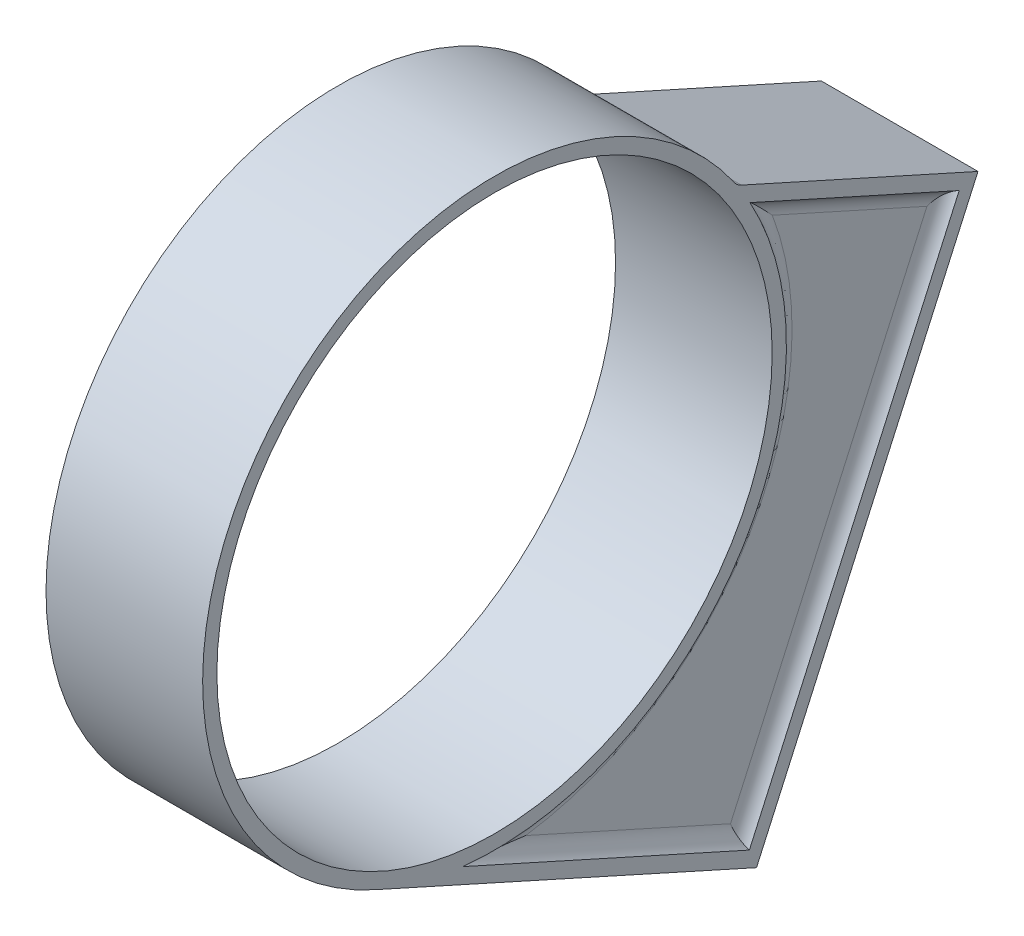
from build123d import *

# Parameters (mm, degrees)
SKETCH1_R           = 205
SKETCH1_R_2         = 195
BOSS_EXTRUDE1_DEPTH = 110
CUT_EXTRUDE1_START  = 41.95
CUT_EXTRUDE1_DEPTH  = 26.1
BOSS_EXTRUDE3_DEPTH = 110
SKETCH5_R           = 10
CUT_EXTRUDE2_DEPTH  = 140
FILLET1_R           = 12.5
CUT_EXTRUDE4_START  = -7.5
CUT_EXTRUDE4_DEPTH  = 7.5
CUT_EXTRUDE5_DEPTH  = 7.5
FILLET2_R           = 12.5


with BuildPart() as part:
    # Sketch1 → Boss-Extrude1 (new body)
    with BuildSketch(Plane(origin=(0, 0, 0), x_dir=(0, 0, -1), z_dir=(1, 0, 0))):
        Circle(SKETCH1_R)
        Circle(SKETCH1_R_2, mode=Mode.SUBTRACT)
    extrude(amount=BOSS_EXTRUDE1_DEPTH)

    # Sketch3 → Cut-Extrude1 (cut)
    with BuildSketch(Plane(origin=(0, 0, 0), x_dir=(0, 0, -1), z_dir=(1, 0, 0)).offset(CUT_EXTRUDE1_START)):
        with BuildLine():
            Line((160.8479694, 127.09418059), (137.885822331, 137.885822331))
            ThreePointArc((137.885822331, 137.885822331), (143.004745144, 132.569388874), (147.918824855, 127.063060145))
            Line((147.918824855, 127.063060145), (167.43543162, 118.280920855))
            ThreePointArc((167.43543162, 118.280920855), (164.200841146, 122.731755332), (160.8479694, 127.09418059))
        make_face()
    extrude(amount=CUT_EXTRUDE1_DEPTH, mode=Mode.SUBTRACT)

    # Sketch4 → Boss-Extrude3 (add)
    with BuildSketch(Plane.ZY):
        with BuildLine():
            Line((-339.535373084, 38.097443801), (-170.172659449, 114.307768661))
            ThreePointArc((-170.172659449, 114.307768661), (-156.650879802, -132.232756371), (84.122100255, -186.945104907))
            Line((84.122100255, -186.945104907), (-183.982931916, -307.587784512))
            Line((-183.982931916, -307.587784512), (-339.535373084, 38.097443801))
        make_face()
    extrude(amount=-BOSS_EXTRUDE3_DEPTH)

    # Sketch5 → Cut-Extrude2 (cut)
    with BuildSketch(Plane(origin=(0, -120.642679605, -268.105032171), x_dir=(-1, 0, 0), z_dir=(0, -0.41035170855993064, -0.9119273410102067))):
        with Locations(Location((-90, -185, 0), (0, 0, 90))):
            Circle(SKETCH5_R)
        with Locations(Location((-20, -185, 0), (0, 0, 90))):
            Circle(SKETCH5_R)
        with Locations(Location((-20, 154.071021086, 0), (0, 0, 90))):
            Circle(SKETCH5_R)
        with Locations(Location((-90, 154.071021086, 0), (0, 0, 90))):
            Circle(SKETCH5_R)
    extrude(amount=-CUT_EXTRUDE2_DEPTH, mode=Mode.SUBTRACT)

    # Fillet1
    fillet1_edges = [part.edges().sort_by_distance(p)[0] for p in [
        (55, 114.307768661, -170.172659449),
    ]]
    fillet(fillet1_edges, radius=FILLET1_R)

    # Sketch6 → Cut-Extrude4 (cut)
    with BuildSketch(Plane(origin=(110, 0, 0), x_dir=(0, 0, -1), z_dir=(1, 0, 0)).offset(CUT_EXTRUDE4_START)):
        with BuildLine():
            Line((326.312582588, 33.081687477), (179.407480032, 99.186471399))
            ThreePointArc((179.407480032, 99.186471399), (170.629059775, -113.625366712), (-22.343234006, -203.778752313))
            Line((-22.343234006, -203.778752313), (178.967175591, -294.364994017))
            Line((178.967175591, -294.364994017), (326.312582588, 33.081687477))
        make_face()
    extrude(amount=CUT_EXTRUDE4_DEPTH, mode=Mode.SUBTRACT)

    # Sketch7 → Cut-Extrude5 (cut)
    with BuildSketch(Plane.ZY):
        with BuildLine():
            Line((-179.407480032, 99.186471399), (-326.312582588, 33.081687477))
            Line((-326.312582588, 33.081687477), (-178.967175591, -294.364994017))
            Line((-178.967175591, -294.364994017), (22.343234006, -203.778752313))
            ThreePointArc((22.343234006, -203.778752313), (-170.629059775, -113.625366712), (-179.407480032, 99.186471399))
        make_face()
    extrude(amount=-CUT_EXTRUDE5_DEPTH, mode=Mode.SUBTRACT)

    # Fillet2
    # the kernel refuses this fillet: 12.5 mm, written as the material it adds along each edge
    with BuildSketch(Plane(origin=(102.5, -192.025828775, 48.461834434), x_dir=(1, 0, 0), z_dir=(0, -0.4103517085599303, -0.9119273410102069))) as fillet2_piece_1_section:
        with BuildLine():
            CenterArc((12.5, -11.456439237), FILLET2_R, 113.578178478, 66.421821522)
            Line((0, -11.456439237), (0, 0))
            Line((0, 0), (7.5, 0))
        make_face()
    fillet2_piece_1 = extrude(amount=249.39378369, mode=Mode.PRIVATE)
    fillet2_piece_1 = fillet2_piece_1 - Plane(origin=(104.520833168, 0, 0), x_dir=(0, 0.4838364458471492, -0.8751584391811569), z_dir=(-1, 0, 0)) * Cylinder(205, 545, mode=Mode.PRIVATE)
    add(fillet2_piece_1)
    with BuildSketch(Plane(origin=(102.5, 0, 0), x_dir=(0, 0.6010821181754732, -0.7991872666713895), z_dir=(0, 0.7991872666713895, 0.6010821181754732))) as fillet2_piece_2_section:
        with BuildLine():
            CenterArc((216.456439237, -12.5), FILLET2_R, 90, 66.421821522)
            Line((216.456439237, 0), (205, 0))
            Line((205, 0), (205, -7.5))
        make_face()
    fillet2_piece_2 = revolve(axis=Axis((102.5, 0, 0), (-1, 0, 0)), revolution_arc=141.215785086, mode=Mode.PRIVATE)
    fillet2_piece_2 = split(fillet2_piece_2, bisect_by=Plane(origin=(104.520833168, -262.670858667, -108.533087047), z_dir=(0, 0.9119273410102068, -0.41035170855993025)), keep=Keep.TOP, mode=Mode.PRIVATE)
    fillet2_piece_2 = split(fillet2_piece_2, bisect_by=Plane(origin=(104.520833168, 64.775822826, -255.878494044), z_dir=(0, -0.9119273410102069, 0.41035170855993014)), keep=Keep.TOP, mode=Mode.PRIVATE)
    add(fillet2_piece_2)
    with BuildSketch(Plane(origin=(102.5, 33.081687477, -326.312582588), x_dir=(1, 0, 0), z_dir=(0, 0.41035170855993014, 0.9119273410102069))) as fillet2_piece_3_section:
        with BuildLine():
            CenterArc((12.5, -11.456439237), FILLET2_R, 113.578178478, 66.421821522)
            Line((0, -11.456439237), (0, 0))
            Line((0, 0), (7.5, 0))
        make_face()
    fillet2_piece_3 = extrude(amount=189.734088675, mode=Mode.PRIVATE)
    fillet2_piece_3 = fillet2_piece_3 - Plane(origin=(104.520833168, 0, 0), x_dir=(0, 0.4838364458471492, -0.8751584391811569), z_dir=(-1, 0, 0)) * Cylinder(205, 426, mode=Mode.PRIVATE)
    add(fillet2_piece_3)
    with BuildSketch(Plane(origin=(102.5, -294.364994017, -178.967175591), x_dir=(1, 0, 0), z_dir=(0, 0.9119273410102068, -0.4103517085599305)), Plane(origin=(7.5, 33.081687477, -326.312582588), x_dir=(-1, 0, 0), z_dir=(0, -0.9119273410102068, 0.41035170855993064))) as fillet2_piece_4:
        with BuildLine():
            CenterArc((12.5, -11.456439237), FILLET2_R, 113.578178478, 66.421821522)
            Line((0, -11.456439237), (0, 0))
            Line((0, 0), (7.5, 0))
        make_face()
    extrude(amount=359.071021086)
    with BuildSketch(Plane(origin=(7.5, -294.364994017, -178.967175591), x_dir=(-1, 0, 0), z_dir=(0, 0.41035170855993075, 0.9119273410102067))) as fillet2_piece_5_section:
        with BuildLine():
            CenterArc((12.5, -11.456439237), FILLET2_R, 113.578178478, 66.421821522)
            Line((0, -11.456439237), (0, 0))
            Line((0, 0), (7.5, 0))
        make_face()
    fillet2_piece_5 = extrude(amount=249.39378369, mode=Mode.PRIVATE)
    fillet2_piece_5 = fillet2_piece_5 - Plane(origin=(5.479166832, 0, 0), x_dir=(0, 0, -1), z_dir=(-1, 0, 0)) * Cylinder(195, 545, mode=Mode.PRIVATE)
    add(fillet2_piece_5)
    with BuildSketch(Plane(origin=(7.5, 110.939394936, -153.288879604), x_dir=(-1, 0, 0), z_dir=(0, -0.4103517085599306, -0.9119273410102067))) as fillet2_piece_6_section:
        with BuildLine():
            CenterArc((12.5, -11.456439237), FILLET2_R, 113.578178478, 66.421821522)
            Line((0, -11.456439237), (0, 0))
            Line((0, 0), (7.5, 0))
        make_face()
    fillet2_piece_6 = extrude(amount=189.734088675, mode=Mode.PRIVATE)
    fillet2_piece_6 = fillet2_piece_6 - Plane(origin=(5.479166832, 0, 0), x_dir=(0, 0, -1), z_dir=(-1, 0, 0)) * Cylinder(195, 426, mode=Mode.PRIVATE)
    add(fillet2_piece_6)
    with BuildSketch(Plane(origin=(7.5, 0, 0), x_dir=(0, -0.9691520376470129, 0.24646364422495046), z_dir=(0, 0.24646364422495046, 0.9691520376470129))) as fillet2_piece_7_section:
        with BuildLine():
            CenterArc((216.456439237, -12.5), FILLET2_R, 90, 66.421821522)
            Line((216.456439237, 0), (205, 0))
            Line((205, 0), (205, -7.5))
        make_face()
    fillet2_piece_7 = revolve(axis=Axis((7.5, 0, 0), (1, 0, 0)), revolution_arc=141.215785086, mode=Mode.PRIVATE)
    fillet2_piece_7 = split(fillet2_piece_7, bisect_by=Plane(origin=(5.479166832, -262.670858667, -108.533087047), z_dir=(0, 0.9119273410102067, -0.41035170855993075)), keep=Keep.TOP, mode=Mode.PRIVATE)
    fillet2_piece_7 = split(fillet2_piece_7, bisect_by=Plane(origin=(5.479166832, 64.775822826, -255.878494044), z_dir=(0, -0.9119273410102067, 0.4103517085599306)), keep=Keep.TOP, mode=Mode.PRIVATE)
    add(fillet2_piece_7)


solid = part.part
